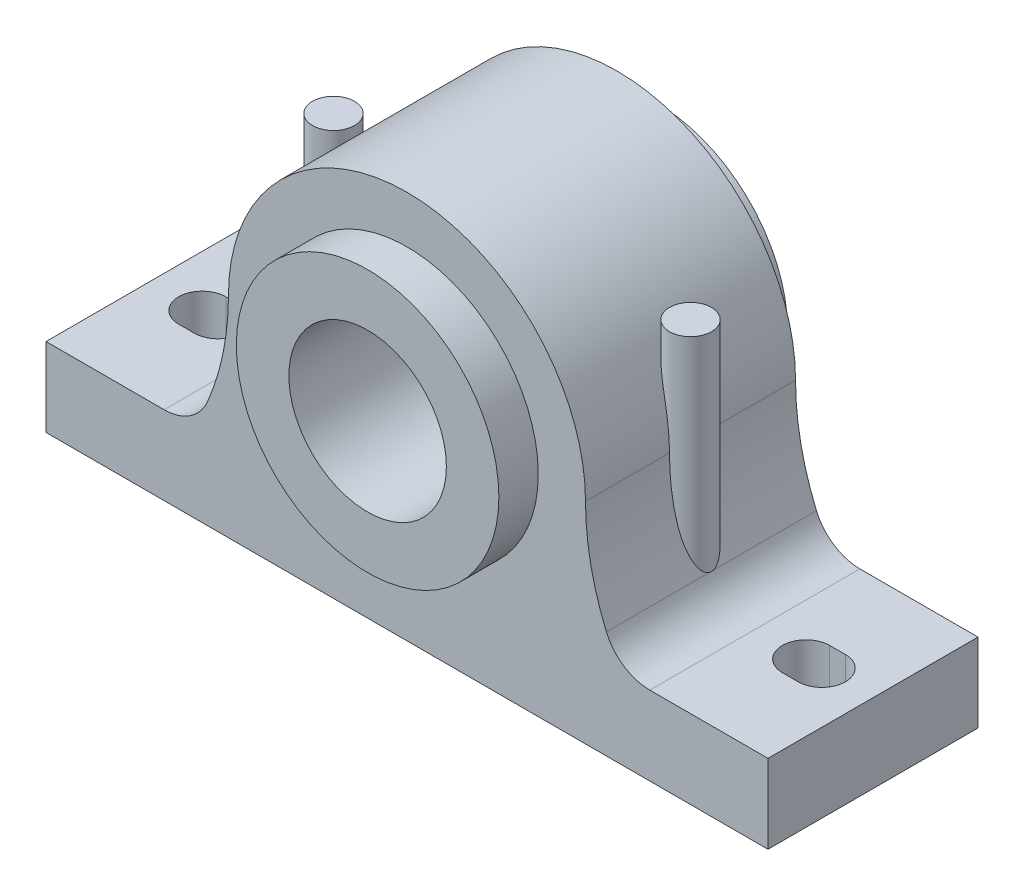
from build123d import *

# Parameters (mm, degrees)
SKETCH1_R                = 30
BOSS_EXTRUDE1_DEPTH      = 40
SKETCH2_R                = 50
SKETCH2_R_2              = 30
BOSS_EXTRUDE2_DEPTH      = 55
CUT_EXTRUDE1_DEPTH       = 110
BOSS_EXTRUDE3_DEPTH      = 40
BOSS_EXTRUDE3_DEPTH_BACK = 60
SKETCH5_R                = 8


with BuildPart() as part:
    # Sketch1 → Boss-Extrude1 (new, symmetric)
    with BuildSketch(Plane.XY):
        with BuildLine():
            Line((137.5, -80), (-137.5, -80))
            Line((-137.5, -80), (-137.5, -50))
            Line((-137.5, -50), (-92.5, -50))
            ThreePointArc((-92.5, -50), (-82.586036695, -47.018171653), (-75.961854895, -39.062156056))
            ThreePointArc((-75.961854895, -39.062156056), (-70.010718453, -19.932656428), (-68, 0))
            ThreePointArc((-68, 0), (0, 68), (68, 0))
            ThreePointArc((68, 0), (70.010718453, -19.932656428), (75.961854895, -39.062156056))
            ThreePointArc((75.961854895, -39.062156056), (82.586036695, -47.018171653), (92.5, -50))
            Line((92.5, -50), (137.5, -50))
            Line((137.5, -50), (137.5, -80))
        make_face()
        Circle(SKETCH1_R, mode=Mode.SUBTRACT)
    extrude(amount=BOSS_EXTRUDE1_DEPTH, both=True)

    # Sketch2 → Boss-Extrude2 (add, symmetric)
    with BuildSketch(Plane.XY):
        Circle(SKETCH2_R)
        Circle(SKETCH2_R_2, mode=Mode.SUBTRACT)
    extrude(amount=BOSS_EXTRUDE2_DEPTH, both=True)

    # Sketch3 → Cut-Extrude1 (cut)
    with BuildSketch(Plane(origin=(0, 0, 0), x_dir=(1, 0, 0), z_dir=(0, 1, 0))):
        with BuildLine():
            Line((-118, 9), (-112, 9))
            ThreePointArc((-112, 9), (-103, 0), (-112, -9))
            Line((-112, -9), (-118, -9))
            ThreePointArc((-118, -9), (-127, 0), (-118, 9))
        make_face()
        with BuildLine():
            Line((118, 9), (112, 9))
            ThreePointArc((112, 9), (103, 0), (112, -9))
            Line((112, -9), (118, -9))
            ThreePointArc((118, -9), (127, 0), (118, 9))
        make_face()
    extrude(amount=-CUT_EXTRUDE1_DEPTH, mode=Mode.SUBTRACT)

    # Sketch5 → Boss-Extrude3 (add, two sides: drawn at the far end of the back side and taken through both)
    with BuildSketch(Plane(origin=(0, 0, 0), x_dir=(1, 0, 0), z_dir=(0, 1, 0)).offset(-BOSS_EXTRUDE3_DEPTH_BACK)):
        with Locations((-68, 0)):
            Circle(SKETCH5_R)
        with Locations((68, 0)):
            Circle(SKETCH5_R)
    extrude(amount=BOSS_EXTRUDE3_DEPTH + BOSS_EXTRUDE3_DEPTH_BACK)


solid = part.part
